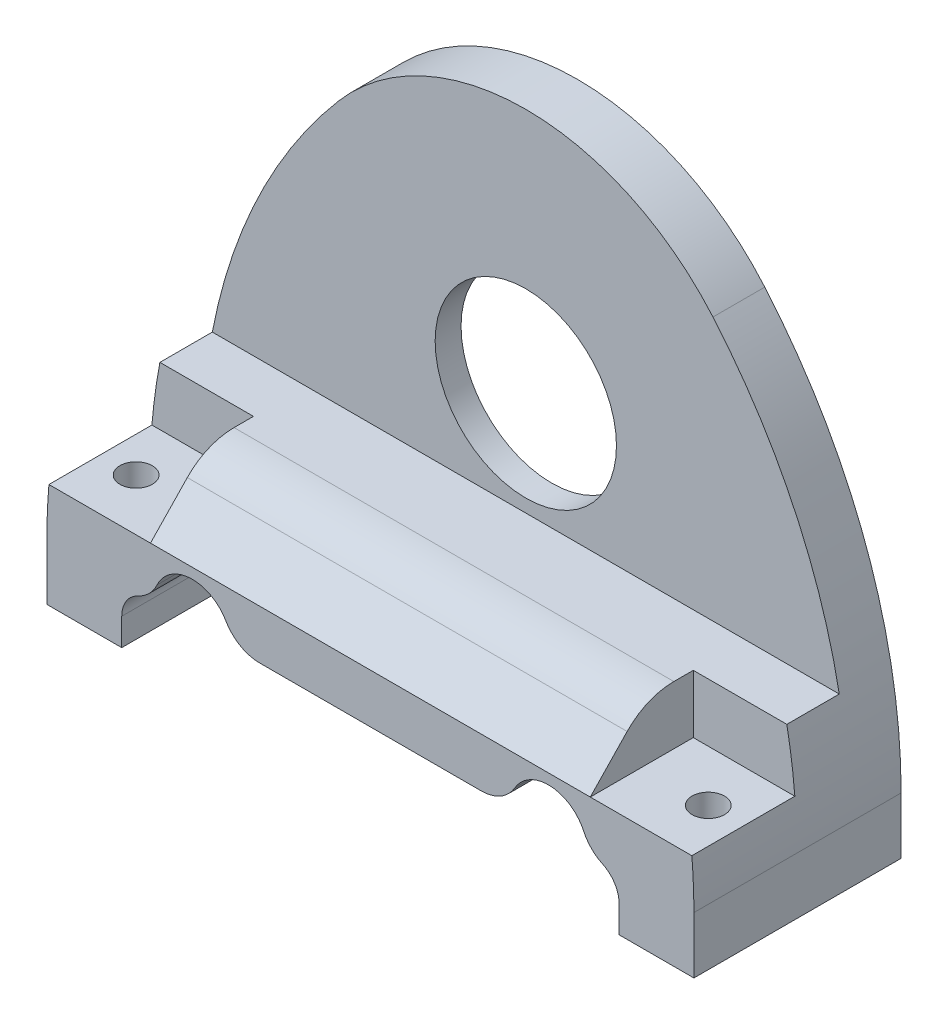
from build123d import *

# Parameters (mm, degrees)
ESBO_O1_R                     = 14.95
RESSALTO_EXTRUS_O1_DEPTH      = 2
ESBO_O2_R                     = 7
RESSALTO_EXTRUS_O2_DEPTH      = 2
ESBO_O3_W                     = 49.96
ESBO_O3_H                     = 12
RESSALTO_EXTRUS_O3_DEPTH      = 8.1
CHANFRO1_SIZE                 = 12.5
CHANFRO1_SIZE_2               = 12
FILETE1_R                     = 44
CORTE_EXTRUS_O1_REACH         = 38.116
CORTE_EXTRUS_O2_DEPTH         = 37.115930003
ESBO_O7_W                     = 49.64413541
ESBO_O7_H                     = 12
CORTE_EXTRUS_O5_DEPTH         = 8
FILETE2_R                     = 5
FURO_ROSCADO_DE_M3X0_51_D     = 2.5
FURO_ROSCADO_DE_M3X0_51_DEPTH = 8.5
FURO_ROSCADO_DE_M3X0_51_TIP   = 0.751075774
CORTE_EXTRUS_O6_DEPTH         = 8
FILETE3_R                     = 3


with BuildPart() as part:
    # Esboço1 → Ressalto-extrusão1 (new body)
    with BuildSketch(Plane.XY):
        with BuildLine():
            Line((-24.98, -20.6), (-24.98, 0))
            Line((-24.98, 0), (-14.451561249, 12.33500618))
            ThreePointArc((-14.451561249, 12.33500618), (0, 19), (14.451561249, 12.33500618))
            Line((14.451561249, 12.33500618), (24.98, 0))
            Line((24.98, 0), (24.98, -20.6))
            Line((24.98, -20.6), (18.98, -20.6))
            Line((18.98, -20.6), (-18.98, -20.6))
            Line((-18.98, -20.6), (-24.98, -20.6))
        make_face()
        Circle(ESBO_O1_R, mode=Mode.SUBTRACT)
    extrude(amount=RESSALTO_EXTRUS_O1_DEPTH)

    # Esboço2 → Ressalto-extrusão2 (add)
    with BuildSketch(Plane.XY.offset(2)):
        with BuildLine():
            Line((24.98, 0), (14.451561249, 12.33500618))
            ThreePointArc((14.451561249, 12.33500618), (0, 19), (-14.451561249, 12.33500618))
            Line((-14.451561249, 12.33500618), (-24.98, 0))
            Line((-24.98, 0), (-24.98, -20.6))
            Line((-24.98, -20.6), (24.98, -20.6))
            Line((24.98, -20.6), (24.98, 0))
        make_face()
        Circle(ESBO_O2_R, mode=Mode.SUBTRACT)
    extrude(amount=RESSALTO_EXTRUS_O2_DEPTH)

    # Esboço3 → Ressalto-extrusão3 (add)
    with BuildSketch(Plane.XZ.offset(20.6)):
        with Locations((0, 10)):
            Rectangle(ESBO_O3_W, ESBO_O3_H)
    extrude(amount=-RESSALTO_EXTRUS_O3_DEPTH)

    # Chanfro1
    # the kernel refuses this chamfer: 12.5, 12 mm, written as the material it adds along each edge
    with BuildSketch(Plane(origin=(-24.98, -12.5, 4), x_dir=(-1.156063365908983e-15, 0.9996377364334812, -0.026914603808079415), z_dir=(1, 0, 0))) as chanfro1_piece_1_section:
        Polygon((CHANFRO1_SIZE * 0.999637736433, CHANFRO1_SIZE * 0.0269146038081), (-CHANFRO1_SIZE_2 * 0.0269146038081, CHANFRO1_SIZE_2 * 0.999637736433), (0, 0), align=None)
    chanfro1_piece_1 = extrude(amount=49.96, mode=Mode.PRIVATE)
    chanfro1_piece_1 = chanfro1_piece_1 - Plane(origin=(0, 0, 8.125756992), x_dir=(1, 0, 0), z_dir=(0, 0, -1)) * Cylinder(7, 150, mode=Mode.PRIVATE)
    add(chanfro1_piece_1)

    # Filete1
    # the kernel refuses this fillet: 44 mm, written as the material it takes off along each edge
    with BuildSketch(Plane(origin=(-24.98, 0, 44.561650607), x_dir=(0.6492108903913877, 0.7606084536719413, 0), z_dir=(0, 0, -1)), Plane(origin=(24.98, 0, -40.561650607), x_dir=(-0.6492108903913875, 0.7606084536719414, 0), z_dir=(0, 0, 1))) as filete1_piece_1:
        with BuildLine():
            CenterArc((16.224665438, 43.999998084), FILETE1_R, 229.517867219, 40.465225033)
            Line((-12.340613739, 10.533226123), (-15.197141656, 7.186548926))
            Line((-15.197141656, 7.186548926), (-1.622466416, -4.399999917))
            Line((-1.622466416, -4.399999917), (16.210382799, -4.399999808))
            Line((16.210382799, -4.399999808), (16.211681221, 0))
        make_face()
    extrude(amount=85.123301215, mode=Mode.SUBTRACT)

    # Esboço4 → Corte-extrusão1 (cut, up to next)
    with BuildSketch(Plane.XY.offset(16), mode=Mode.PRIVATE) as corte_extrus_o1_sk1:
        with BuildLine():
            Line((17, -16.5), (-17, -16.5))
            ThreePointArc((-17, -16.5), (-18.414213562, -17.085786438), (-19, -18.5))
            Line((-19, -18.5), (-19, -20.6))
            Line((-19, -20.6), (19, -20.6))
            Line((19, -20.6), (19, -18.5))
            ThreePointArc((19, -18.5), (18.414213562, -17.085786438), (17, -16.5))
        make_face()
    corte_extrus_o1_tool1 = extrude(corte_extrus_o1_sk1.sketch, amount=-CORTE_EXTRUS_O1_REACH, mode=Mode.PRIVATE) & part.part
    add(corte_extrus_o1_tool1.solids().sort_by_distance((0, -18.567864, 16))[0], mode=Mode.SUBTRACT)

    # Esboço6 → Corte-extrusão2 (cut, through all)
    with BuildSketch(Plane(origin=(0, 0, 0), x_dir=(-1, 0, 0), z_dir=(0, 0, -1))):
        with BuildLine():
            Line((17, -16.3), (16.75, -16.3))
            ThreePointArc((16.75, -16.3), (14.526457135, -13.402222521), (11.151923789, -14.8))
            ThreePointArc((11.151923789, -14.8), (10.053847577, -15.898076211), (8.553847577, -16.3))
            Line((8.553847577, -16.3), (-8.553847577, -16.3))
            ThreePointArc((-8.553847577, -16.3), (-10.053847577, -15.898076211), (-11.151923789, -14.8))
            ThreePointArc((-11.151923789, -14.8), (-14.526457135, -13.402222521), (-16.75, -16.3))
            Line((-16.75, -16.3), (-17, -16.3))
            ThreePointArc((-17, -16.3), (-18.555634919, -16.944365081), (-19.2, -18.5))
            Line((-19.2, -18.5), (-19.2, -20.6))
            Line((-19.2, -20.6), (19.2, -20.6))
            Line((19.2, -20.6), (19.2, -18.5))
            ThreePointArc((19.2, -18.5), (18.555634919, -16.944365081), (17, -16.3))
        make_face()
    extrude(amount=-CORTE_EXTRUS_O2_DEPTH, mode=Mode.SUBTRACT)

    # Esboço7 → Corte-extrusão5 (cut)
    with BuildSketch(Plane(origin=(0, 0, 0), x_dir=(-1, 0, 0), z_dir=(0, -1, 0))):
        with Locations((0, -10)):
            Rectangle(ESBO_O7_W, ESBO_O7_H)
    extrude(amount=CORTE_EXTRUS_O5_DEPTH, mode=Mode.SUBTRACT)

    # Filete2
    filete2_edges = [part.edges().sort_by_distance(p)[0] for p in [
        (0, -8, 11.68),
    ]]
    fillet(filete2_edges, radius=FILETE2_R)

    # Furo roscado de M3x0.51
    with Locations(Plane.XZ.offset(20.6)):
        with Locations((22.09, 4), (22.09, 12), (-22.09, 4), (-22.09, 12)):
            Hole(FURO_ROSCADO_DE_M3X0_51_D / 2, depth=FURO_ROSCADO_DE_M3X0_51_DEPTH)
            with Locations((0, 0, -(FURO_ROSCADO_DE_M3X0_51_DEPTH + FURO_ROSCADO_DE_M3X0_51_TIP / 2))):  # 118° drill point
                Cone(0, FURO_ROSCADO_DE_M3X0_51_D / 2, FURO_ROSCADO_DE_M3X0_51_TIP, mode=Mode.SUBTRACT)

    # Esboço12 → Corte-extrusão6 (cut)
    with BuildSketch(Plane(origin=(24.98, 0, 0), x_dir=(0, 0, -1), z_dir=(1, 0, 0))):
        with BuildLine():
            Line((-9.54891062, -12.5), (-8.04891062, -12.5))
            Line((-8.04891062, -12.5), (-8.04891062, -8))
            Line((-8.04891062, -8), (-9.54891062, -8))
            ThreePointArc((-9.54891062, -8), (-11.509357545, -8.400364378), (-13.155847225, -9.537340859))
            Line((-13.155847225, -9.537340859), (-16, -12.5))
            Line((-16, -12.5), (-9.54891062, -12.5))
        make_face()
    corte_extrus_o6 = extrude(amount=-CORTE_EXTRUS_O6_DEPTH, mode=Mode.SUBTRACT)

    # Espelhar1: Corte-extrusão6 across plane
    add(corte_extrus_o6.mirror(Plane(origin=(0, 0, 0), x_dir=(0, 0, 1), z_dir=(1, 0, 0))), mode=Mode.SUBTRACT)

    # Filete3
    filete3_edges = [part.edges().sort_by_distance(p)[0] for p in [
        (16.75, -16.3, 8),
        (-16.75, -16.3, 8),
    ]]
    fillet(filete3_edges, radius=FILETE3_R)


solid = part.part
